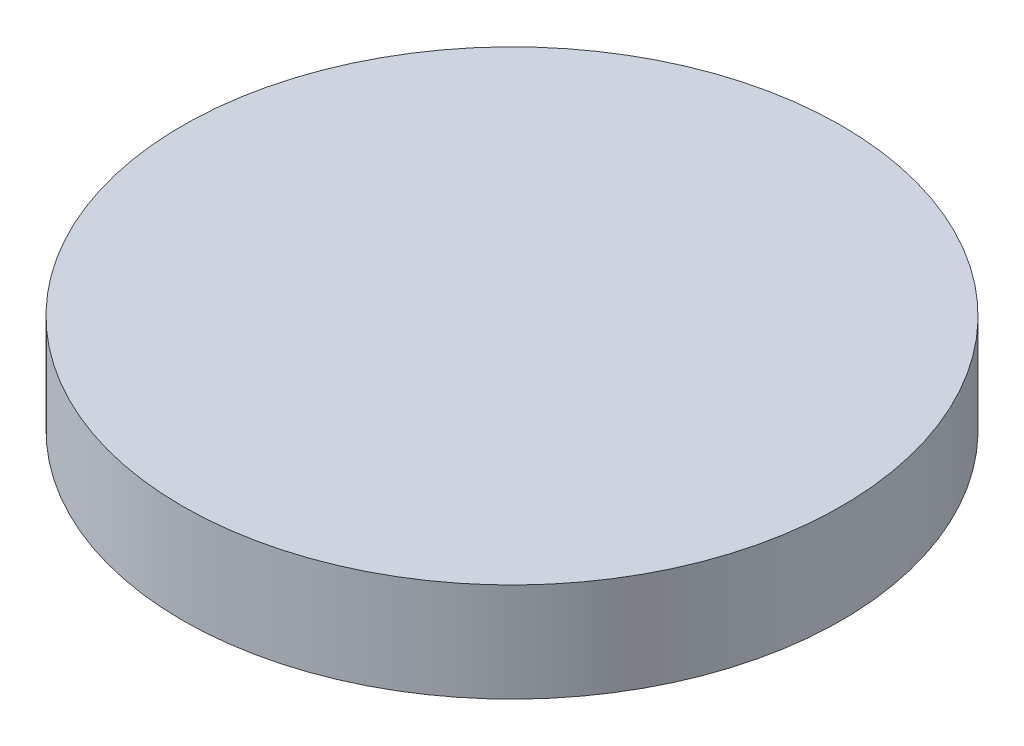
from build123d import *

# Parameters (mm, degrees)
ESQUISSE1_R        = 5
BOSS_EXTRU_1_DEPTH = 1.5


with BuildPart() as part:
    # Esquisse1 → Boss.-Extru.1 (new body)
    with BuildSketch(Plane(origin=(0, 0, 0), x_dir=(-1, 0, 0), z_dir=(0, 1, 0))):
        Circle(ESQUISSE1_R)
    extrude(amount=BOSS_EXTRU_1_DEPTH)


solid = part.part
